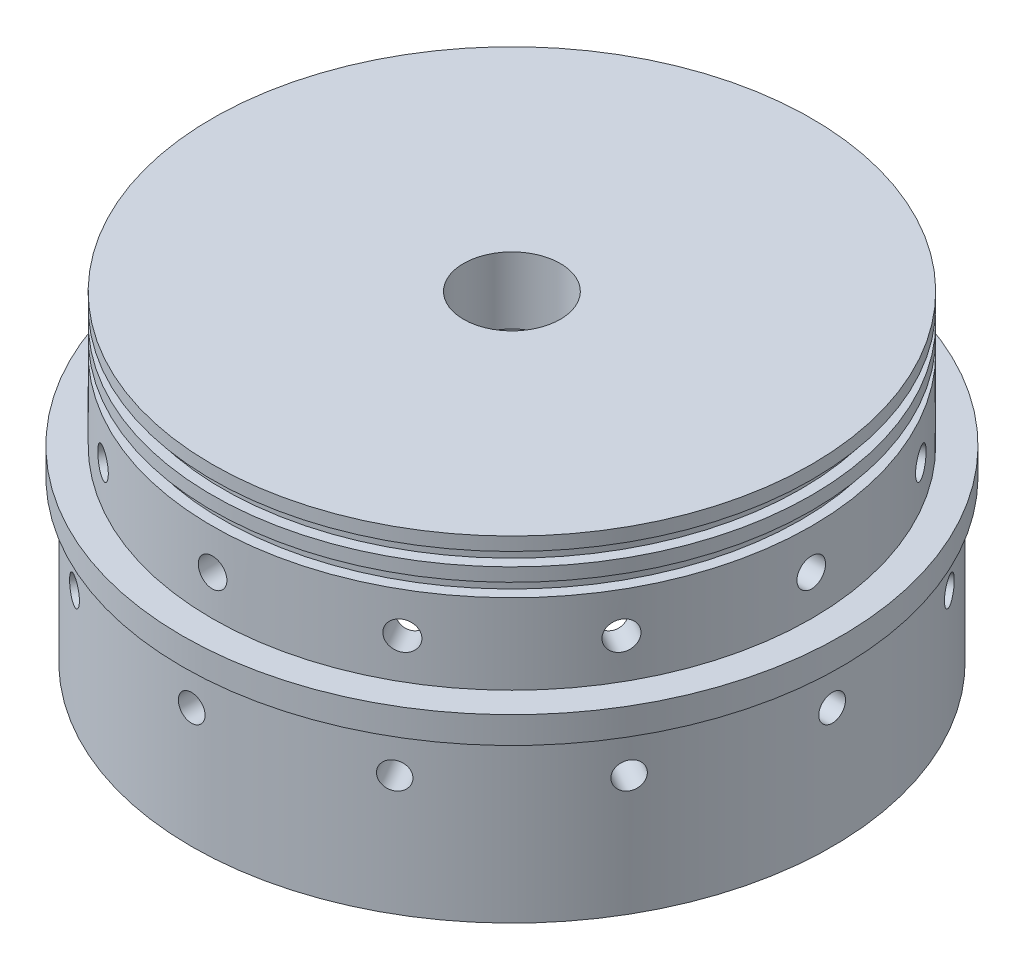
from build123d import *

# Parameters (mm, degrees)
SKETCH1_R                    = 78.359
CENTERRING_TOTOD_THK_DEPTH   = 6.35
SKETCH2_R                    = 71.247
TANKRING_TANKID_HT_DEPTH     = 31.75
SKETCH3_R                    = 76.2
FBRGLSRING_FBRGLSID_HT_DEPTH = 38.1
SKETCH4_R                    = 65.0875
WALL_BLKHDTHK_DEPTH          = 60.325
SKETCH5_W                    = 2.54
SKETCH5_H                    = 3.175
SKETCH6_R                    = 3.4
TANKBOLTHOLE_DEPTH           = 118.183086501
TANKBOLTCOUNT_COUNT          = 12
SKETCH7_R                    = 3.175
FBRGLSBOLTHOLE_DEPTH         = 118.183086534
FBRGLSBOLTCOUNT_COUNT        = 12
SKETCH8_R                    = 11.509375
F_3_4NPTFEMDRILL_DEPTH       = 135.486823805
SMOOTHING_R                  = 12.7
SKETCH9_R                    = 71.4375
FBRGLSRINGTRIM_DEPTH         = 19.05


with BuildPart() as part:
    # Sketch1 → CenterRing(TotOD&Thk) (new body)
    with BuildSketch(Plane(origin=(0, 0, 0), x_dir=(1, 0, 0), z_dir=(0, 1, 0))):
        with Locations(Location((0, 0, 0), (0, 0, 270))):
            Circle(SKETCH1_R)
    extrude(amount=CENTERRING_TOTOD_THK_DEPTH)

    # Sketch2 → TankRing(TankID&Ht) (add)
    with BuildSketch(Plane(origin=(0, 6.35, 0), x_dir=(1, 0, 0), z_dir=(0, 1, 0))):
        with Locations(Location((0, 0, 0), (0, 0, 270))):
            Circle(SKETCH2_R)
    extrude(amount=TANKRING_TANKID_HT_DEPTH)

    # Sketch3 → FbrGlsRing(FbrGlsID&Ht) (add)
    with BuildSketch(Plane.XZ):
        with Locations(Location((0, 0, 0), (0, 0, 90))):
            Circle(SKETCH3_R)
    extrude(amount=FBRGLSRING_FBRGLSID_HT_DEPTH)

    # Sketch4 → Wall&BlkhdThk (cut)
    with BuildSketch(Plane.XZ.offset(38.1)):
        with Locations(Location((0, 0, 0), (0, 0, 270))):
            Circle(SKETCH4_R)
    extrude(amount=-WALL_BLKHDTHK_DEPTH, mode=Mode.SUBTRACT)

    # Sketch5 → O-Ring Channel (revolve, cut)
    with BuildSketch(Plane.XY, mode=Mode.PRIVATE) as o_ring_channel_sk:
        with Locations((-69.977, 33.3375)):
            Rectangle(SKETCH5_W, SKETCH5_H)
        with Locations((-69.977, 26.9875)):
            Rectangle(SKETCH5_W, SKETCH5_H)
    revolve(o_ring_channel_sk.sketch.rotate(Axis((0, 6.35, 0), (0, 1, 0)), 180), axis=Axis((0, 6.35, 0), (0, 1, 0)), mode=Mode.SUBTRACT)

    # Sketch6 → TankBoltHole (cut, through all)
    with BuildSketch(Plane.XY):
        with Locations(Location((0, 15.875, 0), (0, 0, 90))):
            Circle(SKETCH6_R)
    tankbolthole = extrude(amount=-TANKBOLTHOLE_DEPTH, mode=Mode.SUBTRACT)

    # TankBoltCount: TankBoltHole ×12 about axis
    tankboltcount_axis = Axis((0, 38.1, 0), (0, -1, 0))
    for i in range(1, TANKBOLTCOUNT_COUNT):
        add(tankbolthole.rotate(tankboltcount_axis, i * 360 / TANKBOLTCOUNT_COUNT), mode=Mode.SUBTRACT)

    # Sketch7 → FbrGlsBoltHole (cut, through all)
    with BuildSketch(Plane.XY):
        with Locations(Location((0, -9.525, 0), (0, 0, 90))):
            Circle(SKETCH7_R)
    fbrglsbolthole = extrude(amount=-FBRGLSBOLTHOLE_DEPTH, mode=Mode.SUBTRACT)

    # FbrGlsBoltCount: FbrGlsBoltHole ×12 about axis
    fbrglsboltcount_axis = Axis((0, -38.1, 0), (0, 1, 0))
    for i in range(1, FBRGLSBOLTCOUNT_COUNT):
        add(fbrglsbolthole.rotate(fbrglsboltcount_axis, i * 360 / FBRGLSBOLTCOUNT_COUNT), mode=Mode.SUBTRACT)

    # Sketch8 → 3/4NPTFemDrill (cut, through all)
    with BuildSketch(Plane(origin=(0, 38.1, 0), x_dir=(1, 0, 0), z_dir=(0, 1, 0))):
        with Locations(Location((0, 0, 0), (0, 0, 270))):
            Circle(SKETCH8_R)
    extrude(amount=-F_3_4NPTFEMDRILL_DEPTH, mode=Mode.SUBTRACT)

    # Smoothing
    # the kernel refuses this fillet: 12.7 mm, written as the material it adds along each edge
    with BuildSketch(Plane(origin=(0, 22.225, 0), x_dir=(0, 0, -1), z_dir=(-1, 0, 0))) as smoothing_piece_1_section:
        with BuildLine():
            CenterArc((65.0875 - SMOOTHING_R, SMOOTHING_R), SMOOTHING_R, 270, 90)
            Line((65.0875 - SMOOTHING_R, 0), (65.0875, 0))
            Line((65.0875, 0), (65.0875, SMOOTHING_R))
        make_face()
    smoothing_piece_1 = revolve(axis=Axis((0, 22.225, 0), (0, -1, 0)), mode=Mode.PRIVATE)
    smoothing_piece_1 = smoothing_piece_1 - Plane(origin=(0, 15.875, -27.869267869), x_dir=(0, 1, 0), z_dir=(0, 0, -1)) * Cylinder(3.4, 261, mode=Mode.PRIVATE)
    smoothing_piece_1 = smoothing_piece_1 - Plane(origin=(0, 15.875, 0), x_dir=(0, 1, 0), z_dir=(-0.49999999999999994, 0, -0.8660254037844388)) * Cylinder(3.4, 261, mode=Mode.PRIVATE)
    smoothing_piece_1 = smoothing_piece_1 - Plane(origin=(24.13549396, 15.875, 13.934633935), x_dir=(0, 1, 0), z_dir=(-0.8660254037844388, 0, -0.49999999999999983)) * Cylinder(3.4, 261, mode=Mode.PRIVATE)
    smoothing_piece_1 = smoothing_piece_1 - Plane(origin=(48.270987919, 15.875, 0), x_dir=(0, 1, 0), z_dir=(-1, 0, 0)) * Cylinder(3.4, 261, mode=Mode.PRIVATE)
    smoothing_piece_1 = smoothing_piece_1 - Plane(origin=(48.270987919, 15.875, -27.869267869), x_dir=(0, 1, 0), z_dir=(-0.8660254037844386, 0, 0.5000000000000001)) * Cylinder(3.4, 261, mode=Mode.PRIVATE)
    smoothing_piece_1 = smoothing_piece_1 - Plane(origin=(24.13549396, 15.875, -41.803901804), x_dir=(0, 1, 0), z_dir=(-0.49999999999999994, 0, 0.8660254037844387)) * Cylinder(3.4, 261, mode=Mode.PRIVATE)
    add(smoothing_piece_1)

    # Sketch9 → FbrGlsRingTrim (cut)
    with BuildSketch(Plane.XZ.offset(38.1)):
        with Locations(Location((0, 0, 0), (0, 0, 270))):
            Circle(SKETCH9_R)
    extrude(amount=-FBRGLSRINGTRIM_DEPTH, mode=Mode.SUBTRACT)


solid = part.part
